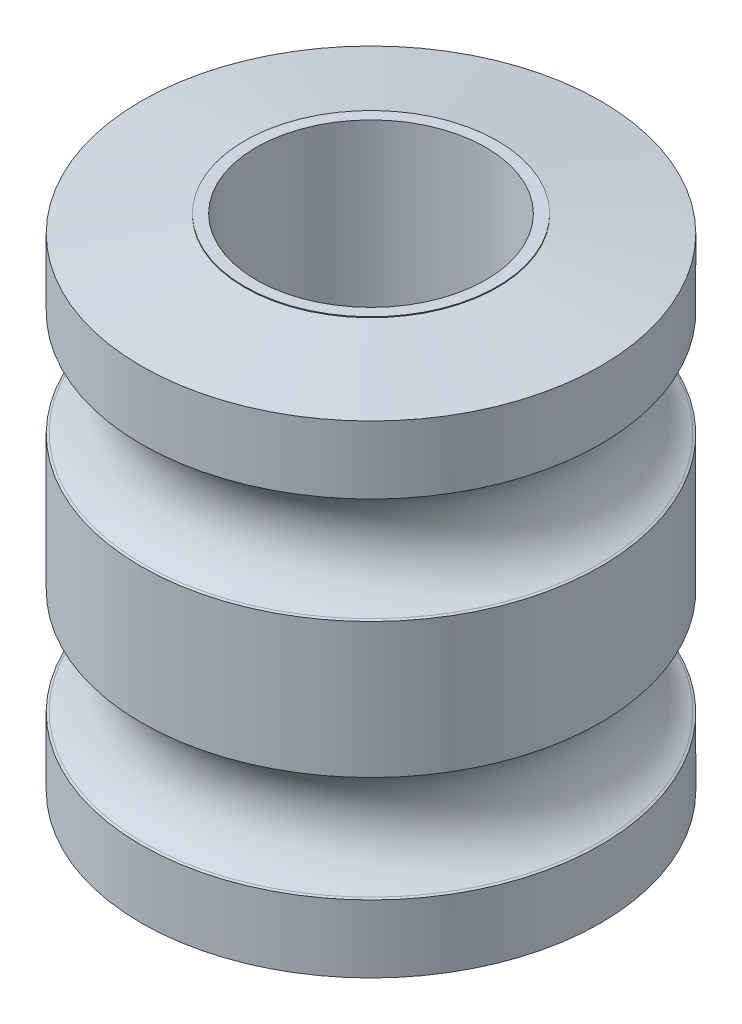
from build123d import *

# Parameters (mm, degrees)
SKETCH1_R           = 5.08
SKETCH1_R_2         = 2.54
BOSS_EXTRUDE1_DEPTH = 2.667
CHAMFER3_SIZE       = 2.5146
CHAMFER3_SIZE2      = 1.172577237
SKETCH3_R           = 2.794
SKETCH3_R_2         = 2.54
BOSS_EXTRUDE2_DEPTH = 0.381
CHAMFER1_SIZE       = 2.286
CHAMFER1_SIZE_2     = 0.362066831
FILLET4_R           = 1.27


with BuildPart() as part:
    # Sketch1 → Boss-Extrude1 (new body)
    with BuildSketch(Plane(origin=(0, 0, 0), x_dir=(1, 0, 0), z_dir=(0, 1, 0))):
        with Locations(Location((0, 0, 0), (0, 0, 270))):
            Circle(SKETCH1_R)
        with Locations(Location((0, 0, 0), (0, 0, 270))):
            Circle(SKETCH1_R_2, mode=Mode.SUBTRACT)
    extrude(amount=BOSS_EXTRUDE1_DEPTH)

    # Chamfer3
    chamfer3_edges = [part.edges().sort_by_distance(p)[0] for p in [
        (0, 0, -5.08),
    ]]
    chamfer3_side = [part.faces().sort_by_distance(p)[0] for p in [
        (0, 0, -4.936315902),
    ]]
    chamfer(chamfer3_edges, length=CHAMFER3_SIZE, length2=CHAMFER3_SIZE2, reference=chamfer3_side[0])

    # Mirror4: part across plane


with BuildPart() as part_1:
    add(part.part)
    add(part.part.mirror(Plane.ZX))

    # Sketch3 → Boss-Extrude2 (add)
    with BuildSketch(Plane(origin=(0, 2.667, 0), x_dir=(1, 0, 0), z_dir=(0, 1, 0))):
        with Locations(Location((0, 0, 0), (0, 0, 90))):
            Circle(SKETCH3_R)
        with Locations(Location((0, 0, 0), (0, 0, 270))):
            Circle(SKETCH3_R_2, mode=Mode.SUBTRACT)
    extrude(amount=BOSS_EXTRUDE2_DEPTH)

    # Chamfer1
    # the kernel refuses this chamfer: 2.286, 0.362066831 mm, written as the material it adds along each edge
    with BuildSketch(Plane(origin=(0, 2.667, 0), x_dir=(0, 0, -1), z_dir=(1, 0, 0))) as chamfer1_piece_1_section:
        Polygon((2.794 + CHAMFER1_SIZE, 0), (2.794, CHAMFER1_SIZE_2 * 0.999999998845), (2.794, 0), align=None)
    chamfer1_piece_1 = revolve(axis=Axis((0, 2.667, 0), (0, 1, 0)), mode=Mode.PRIVATE)
    chamfer1_piece_1 = chamfer1_piece_1 & Plane(origin=(0, 2.832338602, 0), x_dir=(0, 0, 1), z_dir=(0, -1, 0)) * Cylinder(5.08, 21, mode=Mode.PRIVATE)
    add(chamfer1_piece_1)

    # Mirror5: part across plane


with BuildPart() as part_2:
    add(part_1.part)
    add(part_1.part.mirror(Plane(origin=(0, -2.667, 0), x_dir=(0, 0, 1), z_dir=(0, -1, 0))))

    # Fillet4
    fillet4_edges = [part_2.edges().sort_by_distance(p)[0] for p in [
        (0, 0, -2.5654),
        (0, -5.334, -2.5654),
    ]]
    fillet(fillet4_edges, radius=FILLET4_R)


solid = part_2.part
